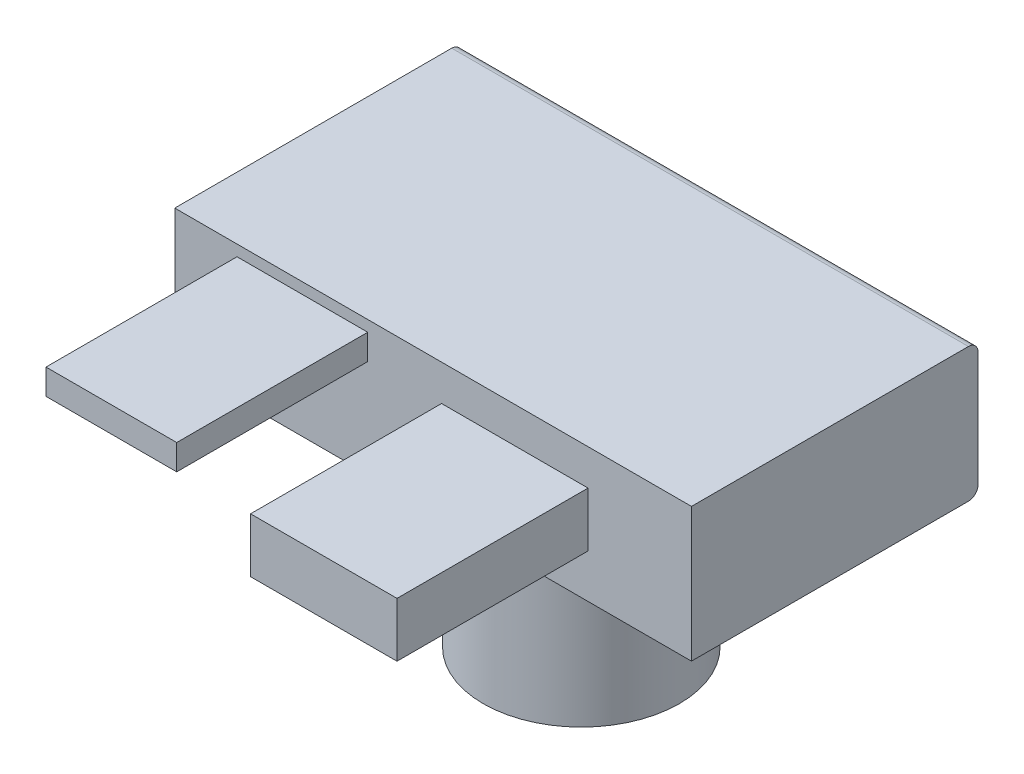
from build123d import *

# Parameters (mm, degrees)
SKETCH1_W           = 137.407001984
SKETCH1_H           = 35.641957088
BOSS_EXTRUDE1_DEPTH = 76.2
SKETCH3_R           = 26.099786647
BOSS_EXTRUDE3_DEPTH = 50.8
SKETCH4_W           = 34.762618313
SKETCH4_H           = 6.759398006
SKETCH4_W_2         = 38.947007555
SKETCH4_H_2         = 14.484424297
BOSS_EXTRUDE4_DEPTH = 50.8
FILLET1_R           = 2.54
FILLET2_R           = 2.54


with BuildPart() as part:
    # Sketch1 → Boss-Extrude1 (new body)
    with BuildSketch(Plane.XY):
        Rectangle(SKETCH1_W, SKETCH1_H)
    extrude(amount=BOSS_EXTRUDE1_DEPTH)

    # Sketch3 → Boss-Extrude3 (add)
    with BuildSketch(Plane.XZ.offset(17.820978544)):
        with Locations((0, 36.792636879)):
            Circle(SKETCH3_R)
    extrude(amount=BOSS_EXTRUDE3_DEPTH)

    # Sketch4 → Boss-Extrude4 (add)
    with BuildSketch(Plane.XY.offset(76.2)):
        with Locations((-34.762618313, 11.507070414)):
            Rectangle(SKETCH4_W, SKETCH4_H)
        with Locations((21.726636446, 1.04609731)):
            Rectangle(SKETCH4_W_2, SKETCH4_H_2)
    extrude(amount=BOSS_EXTRUDE4_DEPTH)

    # Fillet1
    fillet1_edges = [part.edges().sort_by_distance(p)[0] for p in [
        (-26.099786647, -17.820978544, 36.792636879),
    ]]
    fillet(fillet1_edges, radius=FILLET1_R)

    # Fillet2
    fillet2_edges = [part.edges().sort_by_distance(p)[0] for p in [
        (0, -17.820978544, 0),
        (0, 17.820978544, 0),
    ]]
    fillet(fillet2_edges, radius=FILLET2_R)


solid = part.part
